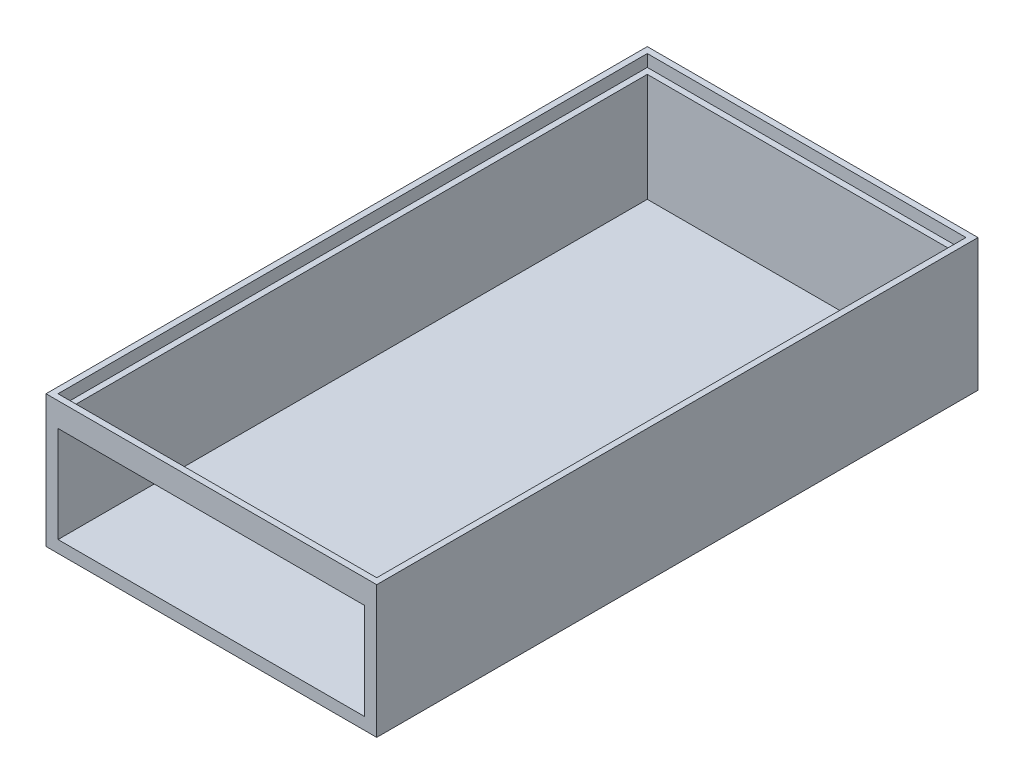
from build123d import *

# Parameters (mm, degrees)
SKETCH1_W           = 139.7
SKETCH1_H           = 254
BOSS_EXTRUDE1_DEPTH = 5.08
SKETCH2_W           = 139.7
SKETCH2_H           = 254
SKETCH2_W_2         = 129.54
SKETCH2_H_2         = 243.84
BOSS_EXTRUDE2_DEPTH = 50.8
SKETCH3_W           = 134.62
SKETCH3_H           = 248.92
SKETCH3_W_2         = 129.54
SKETCH3_H_2         = 243.84
CUT_EXTRUDE1_DEPTH  = 5.08
CUT_EXTRUDE2_REACH  = 297.22
SKETCH4_W           = 129.54
SKETCH4_H           = 40.64


with BuildPart() as part:
    # Sketch1 → Boss-Extrude1 (new body)
    with BuildSketch(Plane(origin=(0, 0, 0), x_dir=(1, 0, 0), z_dir=(0, 1, 0))):
        with Locations((69.85, 127)):
            Rectangle(SKETCH1_W, SKETCH1_H)
    extrude(amount=BOSS_EXTRUDE1_DEPTH)

    # Sketch2 → Boss-Extrude2 (add)
    with BuildSketch(Plane(origin=(0, 5.08, 0), x_dir=(1, 0, 0), z_dir=(0, 1, 0))):
        with Locations((69.85, 127)):
            Rectangle(SKETCH2_W, SKETCH2_H)
        with Locations((69.85, 127)):
            Rectangle(SKETCH2_W_2, SKETCH2_H_2, mode=Mode.SUBTRACT)
    extrude(amount=BOSS_EXTRUDE2_DEPTH)

    # Sketch3 → Cut-Extrude1 (cut)
    with BuildSketch(Plane(origin=(0, 55.88, 0), x_dir=(1, 0, 0), z_dir=(0, 1, 0))):
        with Locations((69.85, 127)):
            Rectangle(SKETCH3_W, SKETCH3_H)
        with Locations((69.85, 127)):
            Rectangle(SKETCH3_W_2, SKETCH3_H_2, mode=Mode.SUBTRACT)
    extrude(amount=-CUT_EXTRUDE1_DEPTH, mode=Mode.SUBTRACT)

    # Sketch4 → Cut-Extrude2 (cut, up to next)
    with BuildSketch(Plane.XY, mode=Mode.PRIVATE) as cut_extrude2_sk1:
        with Locations((69.85, 25.4)):
            Rectangle(SKETCH4_W, SKETCH4_H)
    cut_extrude2_tool1 = extrude(cut_extrude2_sk1.sketch, amount=-CUT_EXTRUDE2_REACH, mode=Mode.PRIVATE) & part.part
    add(cut_extrude2_tool1.solids().sort_by_distance((69.85, 25.4, 0))[0], mode=Mode.SUBTRACT)


solid = part.part
